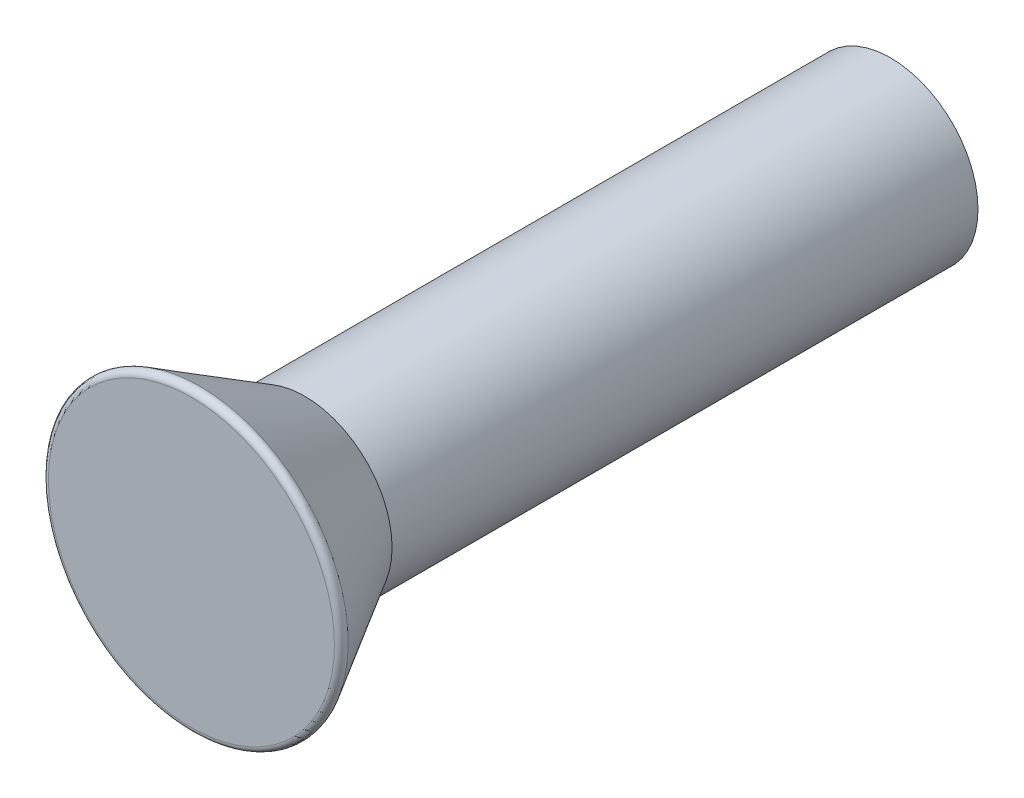
from build123d import *

# Parameters (mm, degrees)
FILLET_2_R = 0.211666667


with BuildPart() as part:
    # BaseBodySke → BaseBody (revolve)
    with BuildSketch(Plane(origin=(0, 0, 0), x_dir=(1, 0, 0), z_dir=(0, 1, 0))):
        Polygon((0, 0), (-5.5626, 0), (-3.175, 4.1148), (-3.175, 25.4), (0, 25.4), align=None)
    revolve(axis=Axis((0, 0, 0), (0, 0, -1)))

    # Fillet 2
    fillet_2_edges = [part.edges().sort_by_distance(p)[0] for p in [
        (5.5626, 0, 0),
    ]]
    fillet(fillet_2_edges, radius=FILLET_2_R)


solid = part.part
